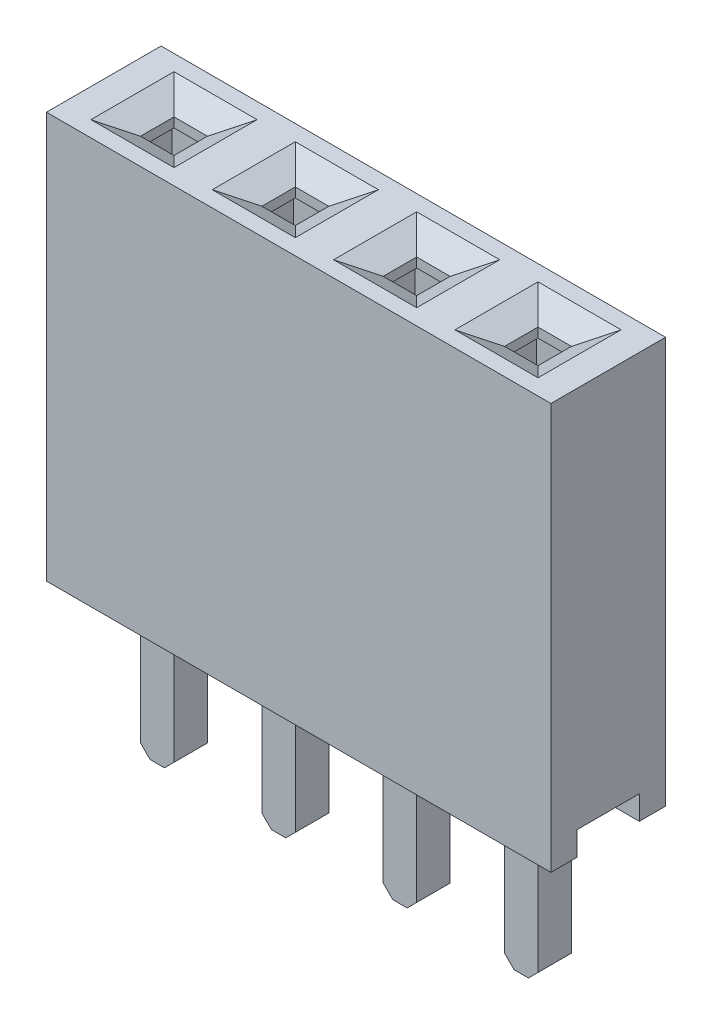
from build123d import *
from OCP.BRepFilletAPI import BRepFilletAPI_MakeChamfer

# Parameters (mm, degrees)
SKETCH8_W              = 10.56
SKETCH8_H              = 2.4
BOSS_EXTRUDE3_DEPTH    = 8.5
SKETCH9_W              = 1.3
SKETCH9_H              = 0.5
CUT_EXTRUDE5_DEPTH     = 14.608952935
SKETCH13_W             = 0.7
SKETCH13_H             = 0.7
CUT_EXTRUDE8_DEPTH     = 13.502723703
CHAMFER4_SIZE          = 0.3
CHAMFER4_SIZE2         = 0.519615242
SKETCH10_W             = 1.373509866
SKETCH10_H             = 1.3
CUT_EXTRUDE6_DEPTH     = 7.5
SKETCH11_W             = 2
SKETCH11_H             = 0.7
CUT_EXTRUDE7_DEPTH     = 6
BOSS_EXTRUDE4_DEPTH    = 0.35
FILLET1_R              = 0.2
FILLET2_SIZE           = 0.4
FILLET2_SIZE_2         = 4.5
CHAMFER5_SIZE          = 0.2
FILLET3_R              = 0.3
LPATTERN17_START       = -0.65
LPATTERN17_DEPTH       = 1.3
LPATTERN17_START_2     = -0.35
LPATTERN17_2_OUTLINE_W = 0.313245067
LPATTERN17_2_OUTLINE_H = 6
LPATTERN17_2_DEPTH     = 0.7
LPATTERN17_START_3     = -0.869615242
LPATTERN17_3_DEPTH     = 1.739230484
LPATTERN17_START_4     = 1
LPATTERN17_4_DEPTH     = 8
LPATTERN18_COUNT       = 4
LPATTERN18_PITCH       = 2.54


with BuildPart() as part:
    # Sketch8 → Boss-Extrude3 (new body)
    with BuildSketch(Plane(origin=(0, 0, 0), x_dir=(1, 0, 0), z_dir=(0, 1, 0))):
        with Locations((3.81, 0)):
            Rectangle(SKETCH8_W, SKETCH8_H)
    extrude(amount=BOSS_EXTRUDE3_DEPTH)

    # Sketch9 → Cut-Extrude5 (cut, through all)
    with BuildSketch(Plane.ZY.offset(1.47)):
        with Locations((0, 0.25)):
            Rectangle(SKETCH9_W, SKETCH9_H)
    extrude(amount=-CUT_EXTRUDE5_DEPTH, mode=Mode.SUBTRACT)

    # Sketch13 → Cut-Extrude8 (cut, through all)
    with BuildSketch(Plane(origin=(0, 8.5, 0), x_dir=(1, 0, 0), z_dir=(0, 1, 0))):
        Rectangle(SKETCH13_W, SKETCH13_H)
    extrude(amount=-CUT_EXTRUDE8_DEPTH, mode=Mode.SUBTRACT)

    # Chamfer4: one chamfer whose edges measure the first distance from different faces: ONE call of the kernel's chamfer builder (chamfer() names one face for all edges)
    chamfer4_edges_1 = [part.edges().sort_by_distance(p)[0] for p in [
        (0.35, 8.5, 0),
    ]]
    chamfer4_side_1 = [part.faces().sort_by_distance(p)[0] for p in [
        (0.35, 4.5, 0),
    ]]
    chamfer4_edges_2 = [part.edges().sort_by_distance(p)[0] for p in [
        (0, 8.5, -0.35),
    ]]
    chamfer4_side_2 = [part.faces().sort_by_distance(p)[0] for p in [
        (0, 4.5, -0.35),
    ]]
    chamfer4_edges_3 = [part.edges().sort_by_distance(p)[0] for p in [
        (-0.35, 8.5, 0),
    ]]
    chamfer4_side_3 = [part.faces().sort_by_distance(p)[0] for p in [
        (-0.35, 4.5, 0),
    ]]
    chamfer4_edges_4 = [part.edges().sort_by_distance(p)[0] for p in [
        (0, 8.5, 0.35),
    ]]
    chamfer4_side_4 = [part.faces().sort_by_distance(p)[0] for p in [
        (0, 4.5, 0.35),
    ]]
    chamfer4 = BRepFilletAPI_MakeChamfer(part.part.solid().wrapped)
    for e in chamfer4_edges_1:
        chamfer4.Add(CHAMFER4_SIZE, CHAMFER4_SIZE2, e.wrapped, chamfer4_side_1[0].wrapped)  # the first distance lies on this face
    for e in chamfer4_edges_2:
        chamfer4.Add(CHAMFER4_SIZE, CHAMFER4_SIZE2, e.wrapped, chamfer4_side_2[0].wrapped)  # the first distance lies on this face
    for e in chamfer4_edges_3:
        chamfer4.Add(CHAMFER4_SIZE, CHAMFER4_SIZE2, e.wrapped, chamfer4_side_3[0].wrapped)  # the first distance lies on this face
    for e in chamfer4_edges_4:
        chamfer4.Add(CHAMFER4_SIZE, CHAMFER4_SIZE2, e.wrapped, chamfer4_side_4[0].wrapped)  # the first distance lies on this face
    add(Compound.cast(chamfer4.Shape()), mode=Mode.REPLACE)

    # Sketch10 → Cut-Extrude6 (cut)
    with BuildSketch(Plane.XZ.offset(-0.5)):
        Rectangle(SKETCH10_W, SKETCH10_H)
    extrude(amount=-CUT_EXTRUDE6_DEPTH, mode=Mode.SUBTRACT)

    # Sketch11 → Cut-Extrude7 (cut)
    with BuildSketch(Plane.XZ.offset(-0.5)):
        Rectangle(SKETCH11_W, SKETCH11_H)
    extrude(amount=-CUT_EXTRUDE7_DEPTH, mode=Mode.SUBTRACT)

    # LPattern17: read off the stored shape, not the designer's step
    # LPattern17 outline → LPattern17 (cut)
    with BuildSketch(Plane.XY.offset(LPATTERN17_START)):
        Polygon((7.27, 8.2), (7.27, 8), (6.933245067, 8), (6.933245067, 0.5), (8.306754933, 0.5), (8.306754933, 8), (7.97, 8), (7.97, 8.2), (8.489615242, 8.5), (6.750384758, 8.5), align=None)
        Polygon((5.43, 8.2), (5.949615242, 8.5), (4.210384758, 8.5), (4.73, 8.2), (4.73, 8), (4.393245067, 8), (4.393245067, 0.5), (5.766754933, 0.5), (5.766754933, 8), (5.43, 8), align=None)
        Polygon((2.89, 8.2), (3.409615242, 8.5), (1.670384758, 8.5), (2.19, 8.2), (2.19, 8), (1.853245067, 8), (1.853245067, 0.5), (3.226754933, 0.5), (3.226754933, 8), (2.89, 8), align=None)
    extrude(amount=LPATTERN17_DEPTH, mode=Mode.SUBTRACT)

    # LPattern17 2 outline → LPattern17 2 (cut)
    with BuildSketch(Plane.XY.offset(LPATTERN17_START_2)):
        with Locations((8.463377467, 3.5)):
            Rectangle(LPATTERN17_2_OUTLINE_W, LPATTERN17_2_OUTLINE_H)
        with Locations((6.776622534, 3.5)):
            Rectangle(LPATTERN17_2_OUTLINE_W, LPATTERN17_2_OUTLINE_H)
        with Locations((5.923377466, 3.5)):
            Rectangle(LPATTERN17_2_OUTLINE_W, LPATTERN17_2_OUTLINE_H)
        with Locations((4.236622534, 3.5)):
            Rectangle(LPATTERN17_2_OUTLINE_W, LPATTERN17_2_OUTLINE_H)
        with Locations((3.383377466, 3.5)):
            Rectangle(LPATTERN17_2_OUTLINE_W, LPATTERN17_2_OUTLINE_H)
        with Locations((1.696622534, 3.5)):
            Rectangle(LPATTERN17_2_OUTLINE_W, LPATTERN17_2_OUTLINE_H)
    extrude(amount=LPATTERN17_2_DEPTH, mode=Mode.SUBTRACT)

    # LPattern17 3 outline → LPattern17 3 (cut)
    with BuildSketch(Plane.XY.offset(LPATTERN17_START_3)):
        Polygon((7.27, 8), (7.97, 8), (7.97, 8.2), (8.489615242, 8.5), (6.750384758, 8.5), (7.27, 8.2), align=None)
        Polygon((5.43, 8.2), (5.949615242, 8.5), (4.210384758, 8.5), (4.73, 8.2), (4.73, 8), (5.43, 8), align=None)
        Polygon((2.89, 8.2), (3.409615242, 8.5), (1.670384758, 8.5), (2.19, 8.2), (2.19, 8), (2.89, 8), align=None)
    extrude(amount=LPATTERN17_3_DEPTH, mode=Mode.SUBTRACT)

    # LPattern17 4 outline → LPattern17 4 (add)
    with BuildSketch(Plane.YZ.offset(LPATTERN17_START_4)):
        Polygon((8.2, -0.35), (8, -0.35), (8, -0.869615242), (8.5, -0.869615242), align=None)
        Polygon((8, 0.35), (8.2, 0.35), (8.5, 0.869615242), (8, 0.869615242), align=None)
    extrude(amount=LPATTERN17_4_DEPTH)


with BuildPart() as body_2:
    # Sketch12 → Boss-Extrude4 (new, symmetric)
    with BuildSketch(Plane.XY):
        with BuildLine():
            Line((1, 0.5), (1, 6.3))
            Line((1, 6.3), (0.5, 6.3))
            add(Edge.make_bspline(
                [(0.309160803, 5.671259854), (0.5, 5.911486281), (0.5, 6.3)],
                knots=[3.808197993, 3.808197993, 3.808197993, 4.71238898, 4.71238898, 4.71238898], degree=2, weights=[1, 0.899533658, 1]))
            add(Edge.make_bspline(
                [(-0.309160803, 5.671259854), (-1.130943922, 1.7), (0, 1.7), (1.130943922, 1.7), (0.309160803, 5.671259854)],
                knots=[0.757385496, 0.757385496, 0.757385496, 3.141592654, 3.141592654, 5.525799811, 5.525799811, 5.525799811], degree=2, weights=[1, 0.369706154, 1, 0.369706154, 1]))
            add(Edge.make_bspline(
                [(-0.5, 6.3), (-0.5, 5.911486281), (-0.309160803, 5.671259854)],
                knots=[1.570796327, 1.570796327, 1.570796327, 2.474987314, 2.474987314, 2.474987314], degree=2, weights=[1, 0.899533658, 1]))
            Line((-0.5, 6.3), (-1, 6.3))
            Line((-1, 6.3), (-1, 0.5))
            Line((-1, 0.5), (-0.35, 0.5))
            Line((-0.35, 0.5), (-0.35, -3))
            Line((-0.35, -3), (0.35, -3))
            Line((0.35, -3), (0.35, 0.5))
            Line((0.35, 0.5), (1, 0.5))
        make_face()
    extrude(amount=BOSS_EXTRUDE4_DEPTH, both=True)

    # Fillet1
    fillet1_edges = [body_2.edges().sort_by_distance(p)[0] for p in [
        (-0.309160803, 5.671259854, 0.175),
        (0.309160803, 5.671259854, 0.175),
    ]]
    fillet(fillet1_edges, radius=FILLET1_R)

    # Fillet2
    # a fillet whose section is not a circle: 4.5, 0.4 mm, written as the material it takes off along each edge
    with BuildSketch(Plane(origin=(-1, 6.3, -11.6), x_dir=(1, 0, 0), z_dir=(0, 0, 1))) as fillet2_piece_1:
        with BuildLine():
            Bezier((FILLET2_SIZE, 0), (0, 0), (0, -FILLET2_SIZE_2), weights=[1, 0.707106781, 1])
            Line((0, -FILLET2_SIZE_2), (0, 0))
            Line((0, 0), (FILLET2_SIZE, 0))
        make_face()
    extrude(amount=23.2, mode=Mode.SUBTRACT)
    with BuildSketch(Plane(origin=(1, 6.3, -11.6), x_dir=(-1, 0, 0), z_dir=(0, 0, 1))) as fillet2_piece_2:
        with BuildLine():
            Bezier((FILLET2_SIZE, 0), (0, 0), (0, FILLET2_SIZE_2), weights=[1, 0.707106781, 1])
            Line((0, FILLET2_SIZE_2), (0, 0))
            Line((0, 0), (FILLET2_SIZE, 0))
        make_face()
    extrude(amount=23.2, mode=Mode.SUBTRACT)

    # Chamfer5
    chamfer5_edges = [body_2.edges().sort_by_distance(p)[0] for p in [
        (0.35, -3, 0),
        (-0.35, -3, 0),
    ]]
    chamfer(chamfer5_edges, length=CHAMFER5_SIZE)

    # Fillet3
    fillet3_edges = [body_2.edges().sort_by_distance(p)[0] for p in [
        (1, 0.5, 0),
        (-1, 0.5, 0),
    ]]
    fillet(fillet3_edges, radius=FILLET3_R)


with BuildPart() as lpattern18_1:
    # LPattern18: pattern copy
    add(body_2.part.moved(Location(Vector(1, 0, 0) * (1 * LPATTERN18_PITCH))))


with BuildPart() as lpattern18_2:
    # LPattern18: pattern copy
    add(body_2.part.moved(Location(Vector(1, 0, 0) * (2 * LPATTERN18_PITCH))))


with BuildPart() as lpattern18_3:
    # LPattern18: pattern copy
    add(body_2.part.moved(Location(Vector(1, 0, 0) * (3 * LPATTERN18_PITCH))))


solid = Compound([part.part, body_2.part, lpattern18_1.part, lpattern18_2.part, lpattern18_3.part])
